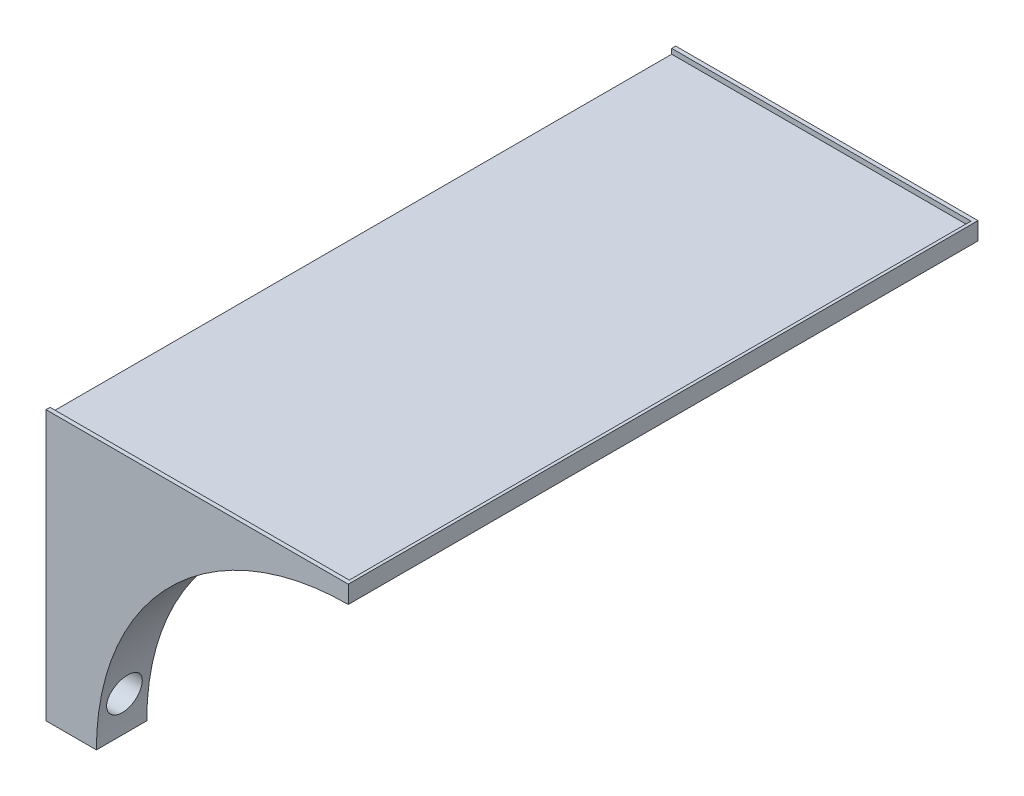
from build123d import *

# Parameters (mm, degrees)
P_IDAT_VYSUNUT_M1_DEPTH                           = 250
SKICA2_W                                          = 120
SKICA2_H                                          = 210
ODEBRAT_VYSUNUT_M1_DEPTH                          = 100
V_LCOV_ZAHLOUBEN_PRO_M6_ROUBY_S_V_LCO_D           = 6.6
V_LCOV_ZAHLOUBEN_PRO_M6_ROUBY_S_V_LCO_CBORE_D     = 14
V_LCOV_ZAHLOUBEN_PRO_M6_ROUBY_S_V_LCO_CBORE_DEPTH = 115
P_IDAT_VYSUNUT_M2_DEPTH                           = 2
ZKOSEN_1_SIZE                                     = 2


with BuildPart() as part:
    # Skica1 → Přidat vysunutím1 (new body)
    with BuildSketch(Plane.XY):
        with BuildLine():
            Line((0, 0), (0, 105))
            Line((0, 105), (120, 105))
            Line((120, 105), (120, 100))
            ThreePointArc((120, 100), (49.289321881, 70.710678119), (20, 0))
            Line((20, 0), (0, 0))
        make_face()
    extrude(amount=P_IDAT_VYSUNUT_M1_DEPTH)

    # Skica2 → Odebrat vysunutím1 (cut)
    with BuildSketch(Plane.XZ):
        with Locations((60, 125)):
            Rectangle(SKICA2_W, SKICA2_H)
    extrude(amount=-ODEBRAT_VYSUNUT_M1_DEPTH, mode=Mode.SUBTRACT)

    # Válcové zahloubení pro M6 šrouby s válcovou hlavou zaoblenou1 (through all)
    with Locations(Plane(origin=(120, 0, 0), x_dir=(0, 0, -1), z_dir=(1, 0, 0))):
        with Locations((-240, 91), (-240, 15)):
            v_lcov_zahlouben_pro_m6_rouby_s_v_lco = CounterBoreHole(V_LCOV_ZAHLOUBEN_PRO_M6_ROUBY_S_V_LCO_D / 2, V_LCOV_ZAHLOUBEN_PRO_M6_ROUBY_S_V_LCO_CBORE_D / 2, V_LCOV_ZAHLOUBEN_PRO_M6_ROUBY_S_V_LCO_CBORE_DEPTH)

    # Zrcadlit1: Válcové zahloubení pro M6 šrouby s válcovou hlavou zaoblenou1 across plane
    add(v_lcov_zahlouben_pro_m6_rouby_s_v_lco.mirror(Plane.XY.offset(125)), mode=Mode.SUBTRACT)

    # Skica8 → Přidat vysunutím2 (add)
    with BuildSketch(Plane(origin=(0, 105, 0), x_dir=(1, 0, 0), z_dir=(0, 1, 0))):
        Polygon((0, 0), (120, 0), (120, -250), (0, -250), (0, -248.4), (116.8, -248.4), (116.8, -1.6), (0, -1.6), align=None)
    extrude(amount=P_IDAT_VYSUNUT_M2_DEPTH)

    # Zkosení1
    zkosen_1_edges = [part.edges().sort_by_distance(p)[0] for p in [
        (116.8, 107, 125),
    ]]
    chamfer(zkosen_1_edges, length=ZKOSEN_1_SIZE - 0.0001)  # a hair under: the kernel refuses the full size


solid = part.part
